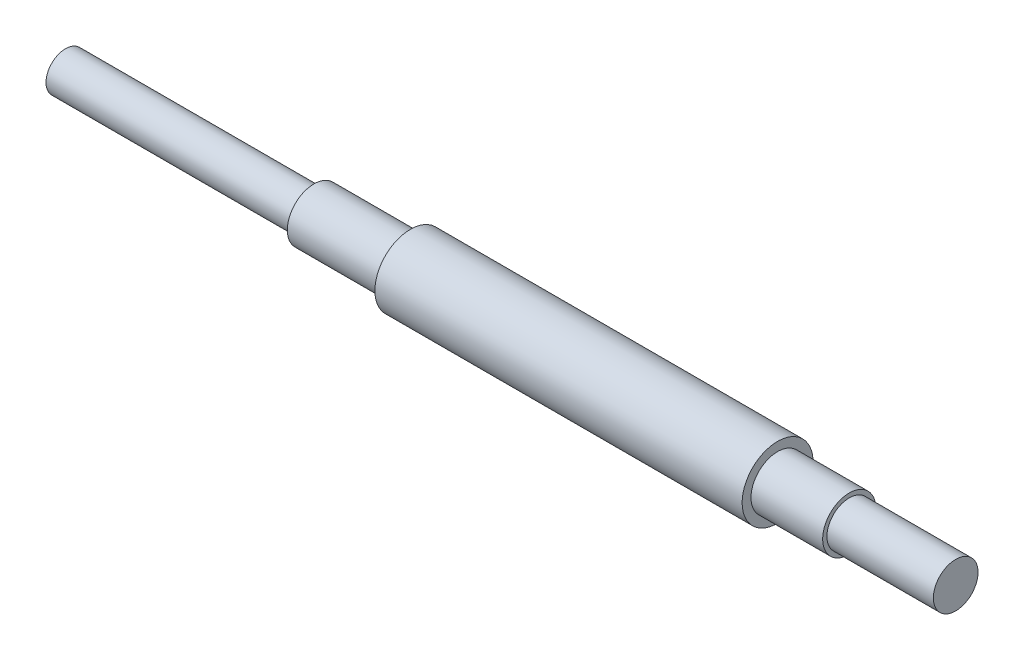
from build123d import *


with BuildPart() as part:
    # Sketch1 → Revolve1 (revolve)
    with BuildSketch(Plane(origin=(0, 0, 0), x_dir=(1, 0, 0), z_dir=(0, 1, 0))):
        Polygon((-78.63058905, 0), (-78.63058905, 3.499993), (-34.18058905, 3.499993), (-34.18058905, 4.7625), (-16.92514985, 4.7625), (-16.92514985, 6.35), (48.79481015, 6.35), (48.79481015, 4.7625), (61.61617135, 4.7625), (61.61617135, 3.99923), (80.66617135, 3.99923), (80.66617135, 0), align=None)
    revolve(axis=Axis((-97.950567047, 0, 0), (1, 0, 0)))


solid = part.part
